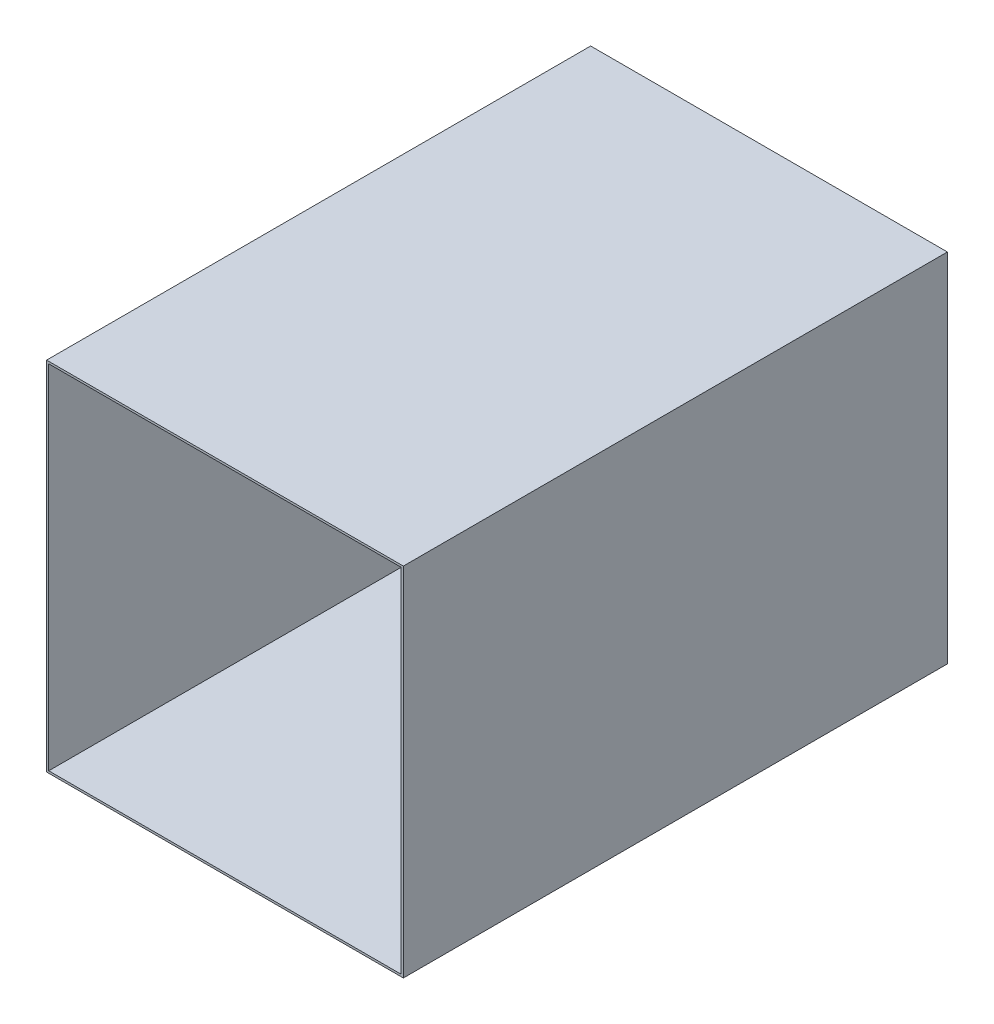
from build123d import *

# Parameters (mm, degrees)
SKETCH1_W           = 500
SKETCH1_H           = 500
SKETCH1_W_2         = 494
SKETCH1_H_2         = 494
BOSS_EXTRUDE1_DEPTH = 762.5


with BuildPart() as part:
    # Sketch1 → Boss-Extrude1 (new body)
    with BuildSketch(Plane.XY):
        with Locations((0, 250)):
            Rectangle(SKETCH1_W, SKETCH1_H)
        with Locations((0, 250)):
            Rectangle(SKETCH1_W_2, SKETCH1_H_2, mode=Mode.SUBTRACT)
    extrude(amount=BOSS_EXTRUDE1_DEPTH)


solid = part.part
